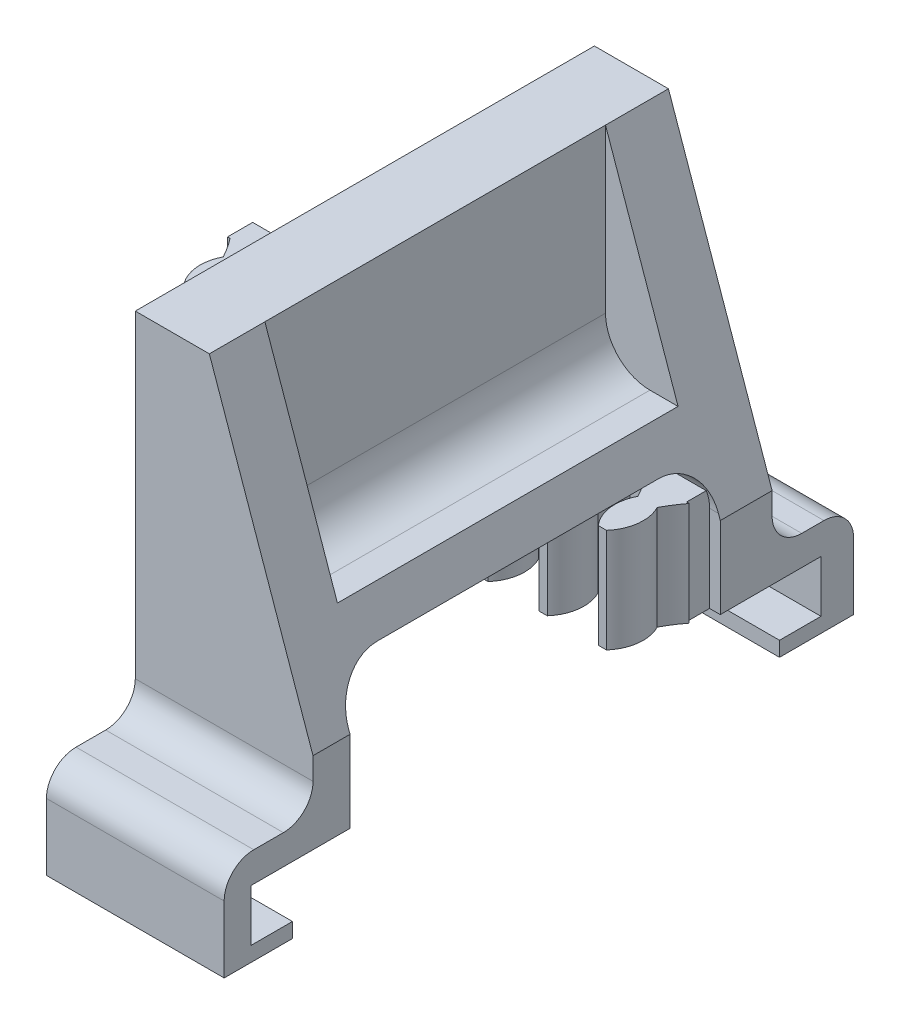
from build123d import *

# Parameters (mm, degrees)
BOSS_EXTRUDE1_DEPTH = 31
SKETCH4_W           = 25
SKETCH4_H           = 15
CUT_EXTRUDE2_DEPTH  = 25
CUT_EXTRUDE4_DEPTH  = 11.5
SKETCH7_W           = 31
SKETCH7_H           = 1.7
BOSS_EXTRUDE3_DEPTH = 7
BOSS_EXTRUDE4_DEPTH = 7
LPATTERN1_COUNT     = 8
LPATTERN1_PITCH     = 4
SKETCH11_W          = 12
SKETCH11_H          = 6.5
BOSS_EXTRUDE5_DEPTH = 5.5
FILLET5_R           = 3
SKETCH12_W          = 12
SKETCH12_H          = 6.5
BOSS_EXTRUDE6_DEPTH = 6
CUT_EXTRUDE5_DEPTH  = 12
FILLET6_R           = 2


with BuildPart() as part:
    # Sketch1 → Boss-Extrude1 (new body)
    with BuildSketch(Plane.XY):
        Polygon((0, 0), (0, -30), (12, -30), (12, -20), (5, 0), align=None)
    extrude(amount=-BOSS_EXTRUDE1_DEPTH)

    # Sketch4 → Cut-Extrude2 (cut)
    with BuildSketch(Plane.ZY):
        with Locations((-15, -24.143402944)):
            Rectangle(SKETCH4_W, SKETCH4_H)
    extrude(amount=-CUT_EXTRUDE2_DEPTH, mode=Mode.SUBTRACT)

    # Sketch6 → Cut-Extrude4 (cut, symmetric)
    with BuildSketch(Plane.XY.offset(-15.25)):
        Polygon((5, 0), (5, -14), (9.9, -14), align=None)
    extrude(amount=CUT_EXTRUDE4_DEPTH, both=True, mode=Mode.SUBTRACT)

    # Sketch7 → Boss-Extrude3 (add)
    with BuildSketch(Plane(origin=(0, -25.5, 0), x_dir=(1, 0, 0), z_dir=(0, 1, 0))):
        with Locations((-4.2231607, 26.8)):
            Rectangle(SKETCH7_W, SKETCH7_H)
    extrude(amount=BOSS_EXTRUDE3_DEPTH)

    # Sketch10 → Boss-Extrude4 (add)
    with BuildSketch(Plane(origin=(0, -25.5, 0), x_dir=(1, 0, 0), z_dir=(0, 1, 0))):
        with BuildLine():
            Line((10.229764516, 21.588776044), (9.674536509, 21.588776044))
            ThreePointArc((9.674536509, 21.588776044), (9.015771799, 23.054925169), (9.300491414, 24.636854036))
            ThreePointArc((9.300491414, 24.636854036), (8.903062553, 25.310703075), (8.452150513, 25.95))
            Line((8.452150513, 25.95), (11.452150513, 25.95))
            ThreePointArc((11.452150513, 25.95), (11.001238473, 25.310703075), (10.603809612, 24.636854036))
            ThreePointArc((10.603809612, 24.636854036), (10.888529227, 23.054925169), (10.229764516, 21.588776044))
        make_face()
    boss_extrude4 = extrude(amount=BOSS_EXTRUDE4_DEPTH)

    # LPattern1: Boss-Extrude4 ×8
    with Locations(*[(-i * LPATTERN1_PITCH, 0, 0) for i in range(1, LPATTERN1_COUNT)]):
        add(boss_extrude4)

    # Sketch11 → Boss-Extrude5 (add)
    with BuildSketch(Plane(origin=(0, 0, -31), x_dir=(-1, 0, 0), z_dir=(0, 0, -1))):
        with Locations((-6, -26.75)):
            Rectangle(SKETCH11_W, SKETCH11_H)
    extrude(amount=BOSS_EXTRUDE5_DEPTH)

    # Fillet5
    # the kernel refuses this fillet: 3 mm, written as the material it adds along each edge
    with BuildSketch(Plane(origin=(5, -14, -34.25), x_dir=(0, 1, 0), z_dir=(0, 0, 1))) as fillet5_piece_1_section:
        with BuildLine():
            CenterArc((FILLET5_R, -FILLET5_R), FILLET5_R, 90, 90)
            Line((0, -FILLET5_R), (0, 0))
            Line((0, 0), (FILLET5_R, 0))
        make_face()
    fillet5_piece_1 = extrude(amount=38, mode=Mode.PRIVATE)
    fillet5_piece_1 = split(fillet5_piece_1, bisect_by=Plane(origin=(5.670103817, -13.329896183, -31), z_dir=(0, 0, 1)), keep=Keep.TOP, mode=Mode.PRIVATE)
    fillet5_piece_1 = split(fillet5_piece_1, bisect_by=Plane(origin=(5.670103817, -13.329896183, 0), z_dir=(0, 0, -1)), keep=Keep.TOP, mode=Mode.PRIVATE)
    add(fillet5_piece_1)
    with BuildSketch(Plane(origin=(0, -16.643402944, -2.5), x_dir=(0, -1, 0), z_dir=(1, 0, 0))) as fillet5_piece_2_section:
        with BuildLine():
            CenterArc((FILLET5_R, FILLET5_R), FILLET5_R, 180, 90)
            Line((0, FILLET5_R), (0, 0))
            Line((0, 0), (FILLET5_R, 0))
        make_face()
    fillet5_piece_2 = extrude(amount=18.32519103, mode=Mode.PRIVATE)
    fillet5_piece_2 = split(fillet5_piece_2, bisect_by=Plane(origin=(10.459559167, -15.598740478, -3.164212855), z_dir=(-0.9438583563660173, -0.33035042472810633, 0)), keep=Keep.TOP, mode=Mode.PRIVATE)
    add(fillet5_piece_2)
    with BuildSketch(Plane(origin=(0, -16.643402944, -27.5), x_dir=(0, 0, 1), z_dir=(1, 0, 0))) as fillet5_piece_3_section:
        with BuildLine():
            CenterArc((FILLET5_R, FILLET5_R), FILLET5_R, 180, 90)
            Line((0, FILLET5_R), (0, 0))
            Line((0, 0), (FILLET5_R, 0))
        make_face()
    fillet5_piece_3 = extrude(amount=18.32519103, mode=Mode.PRIVATE)
    fillet5_piece_3 = split(fillet5_piece_3, bisect_by=Plane(origin=(10.435387917, -15.529679764, -26.806522223), z_dir=(-0.9438583563660173, -0.33035042472810633, 0)), keep=Keep.TOP, mode=Mode.PRIVATE)
    add(fillet5_piece_3)

    # Sketch12 → Boss-Extrude6 (add)
    with BuildSketch(Plane.XY):
        with Locations((6, -26.75)):
            Rectangle(SKETCH12_W, SKETCH12_H)
    extrude(amount=BOSS_EXTRUDE6_DEPTH)

    # Sketch13 → Cut-Extrude5 (cut)
    with BuildSketch(Plane.ZY):
        Polygon((-34.3, -25.5), (-27.5, -25.5), (-27.5, -32.069121633), (-31.5, -32.069121633), (-31.5, -29), (-34.3, -29), align=None)
        Polygon((1.387837299, -29), (4.187837299, -29), (4.187837299, -25.5), (-2.612162701, -25.5), (-2.612162701, -32.069121633), (1.387837299, -32.069121633), align=None)
    extrude(amount=-CUT_EXTRUDE5_DEPTH, mode=Mode.SUBTRACT)

    # Fillet6
    fillet6_edges = [part.edges().sort_by_distance(p)[0] for p in [
        (6, -23.5, -31),
        (6, -23.5, -36.5),
        (6, -23.5, 0),
        (6, -23.5, 6),
    ]]
    fillet(fillet6_edges, radius=FILLET6_R)


solid = part.part
